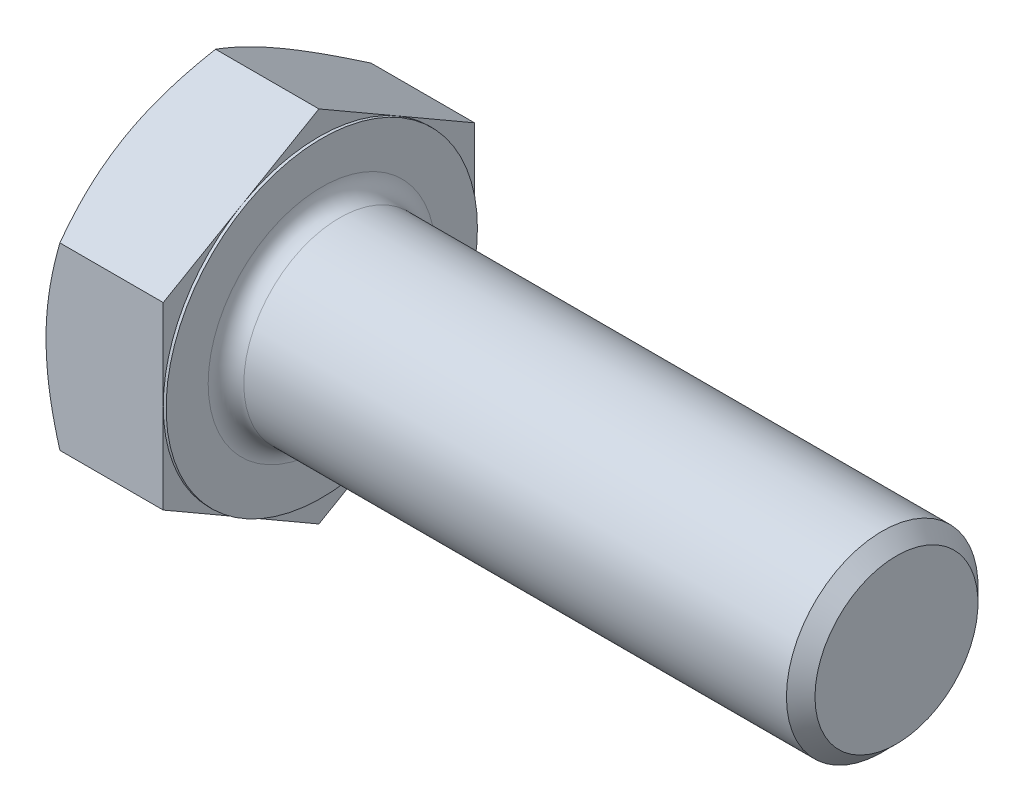
from build123d import *

# Parameters (mm, degrees)
BASEHEAD_DEPTH = 15.9258
SKETCH4_W      = 0.381
SKETCH4_H      = 28.592632361
HEADFILLET_R   = 2.3622


with BuildPart() as part:
    # Sketch1 → BaseHead (new body)
    with BuildSketch(Plane(origin=(0, 0, 0), x_dir=(0, 0, -1), z_dir=(1, 0, 0))):
        Polygon((20.6375, 11.91506618), (20.6375, -11.91506618), (0, -23.830132361), (-20.6375, -11.91506618), (-20.6375, 11.91506618), (0, 23.830132361), align=None)
    extrude(amount=BASEHEAD_DEPTH)

    # BodySke → BaseBody (revolve)
    with BuildSketch(Plane.XY):
        Polygon((0, 0), (92.1258, 0), (92.1258, 10.8077), (90.2335, 12.7), (0, 12.7), align=None)
    revolve(axis=Axis((0, 0, 0), (1, 0, 0)))

    # Sketch3 → HeadChamfer (revolve, cut)
    with BuildSketch(Plane.XY):
        Polygon((0, 20.6375), (5.509441362, 30.180132361), (5.509441362, 36.530132361), (-12.7, 36.530132361), (-12.7, 20.6375), align=None)
    revolve(axis=Axis((0, 0, 0), (1, 0, 0)), mode=Mode.SUBTRACT)

    # Sketch4 → BearingFace (revolve, cut)
    with BuildSketch(Plane.XY):
        with Locations((15.7353, 34.933816181)):
            Rectangle(SKETCH4_W, SKETCH4_H)
    revolve(axis=Axis((0, 0, 0), (1, 0, 0)), mode=Mode.SUBTRACT)

    # HeadFillet
    headfillet_edges = [part.edges().sort_by_distance(p)[0] for p in [
        (15.9258, -12.7, 0),
    ]]
    fillet(headfillet_edges, radius=HEADFILLET_R)


solid = part.part
